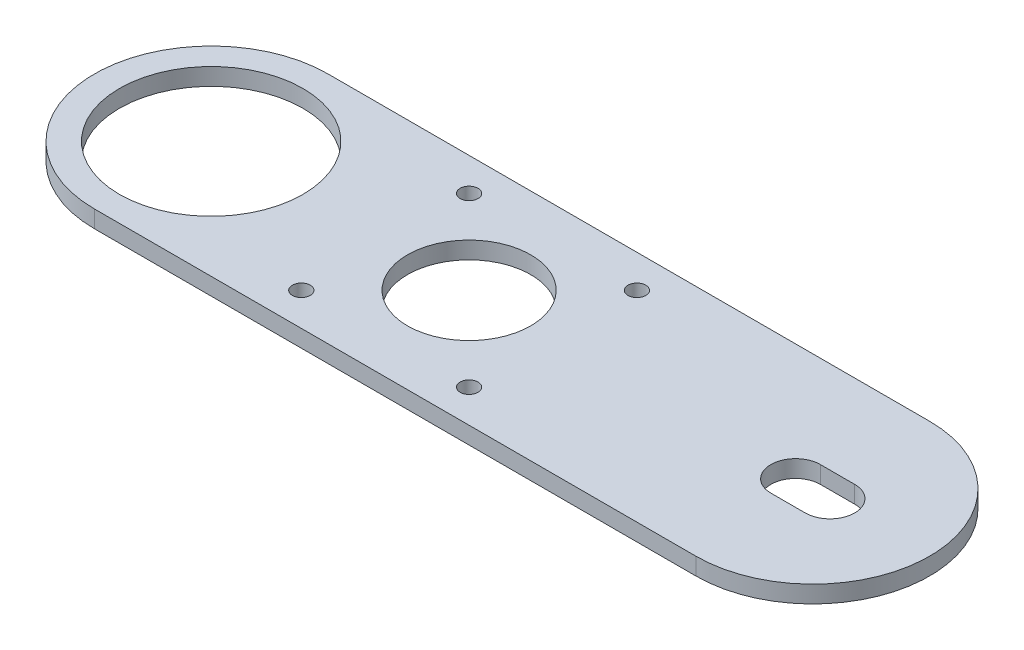
from build123d import *

# Parameters (mm, degrees)
SKETCH1_R           = 16.9545
SKETCH1_R_2         = 4.572
SKETCH1_R_3         = 11.380999971
SKETCH1_R_4         = 1.651
BOSS_EXTRUDE1_DEPTH = 3.175
CUT_EXTRUDE1_DEPTH  = 135.522200834


with BuildPart() as part:
    # Sketch1 → Boss-Extrude1 (new body)
    with BuildSketch(Plane(origin=(0, 0, 0), x_dir=(1, 0, 0), z_dir=(0, 1, 0))):
        with BuildLine():
            Line((0, 21.59), (111.1504, 21.59))
            ThreePointArc((111.1504, 21.59), (132.7404, 0), (111.1504, -21.59))
            Line((111.1504, -21.59), (0, -21.59))
            ThreePointArc((0, -21.59), (-21.59, 0), (0, 21.59))
        make_face()
        Circle(SKETCH1_R, mode=Mode.SUBTRACT)
        with Locations((111.1504, 0)):
            Circle(SKETCH1_R_2, mode=Mode.SUBTRACT)
        with Locations((47.6504, 0)):
            Circle(SKETCH1_R_3, mode=Mode.SUBTRACT)
        with Locations((32.1504, -15.5)):
            Circle(SKETCH1_R_4, mode=Mode.SUBTRACT)
        with Locations((32.1504, 15.5)):
            Circle(SKETCH1_R_4, mode=Mode.SUBTRACT)
        with Locations((63.1504, 15.5)):
            Circle(SKETCH1_R_4, mode=Mode.SUBTRACT)
        with Locations((63.1504, -15.5)):
            Circle(SKETCH1_R_4, mode=Mode.SUBTRACT)
    extrude(amount=BOSS_EXTRUDE1_DEPTH)

    # Sketch2 → Cut-Extrude1 (cut, through all)
    with BuildSketch(Plane(origin=(0, 3.175, 0), x_dir=(1, 0, 0), z_dir=(0, 1, 0))):
        with BuildLine():
            Line((114.3254, -4.572), (107.9754, -4.572))
            ThreePointArc((107.9754, -4.572), (103.4034, 0), (107.9754, 4.572))
            Line((107.9754, 4.572), (114.3254, 4.572))
            ThreePointArc((114.3254, 4.572), (118.8974, 0), (114.3254, -4.572))
        make_face()
    extrude(amount=-CUT_EXTRUDE1_DEPTH, mode=Mode.SUBTRACT)


solid = part.part
